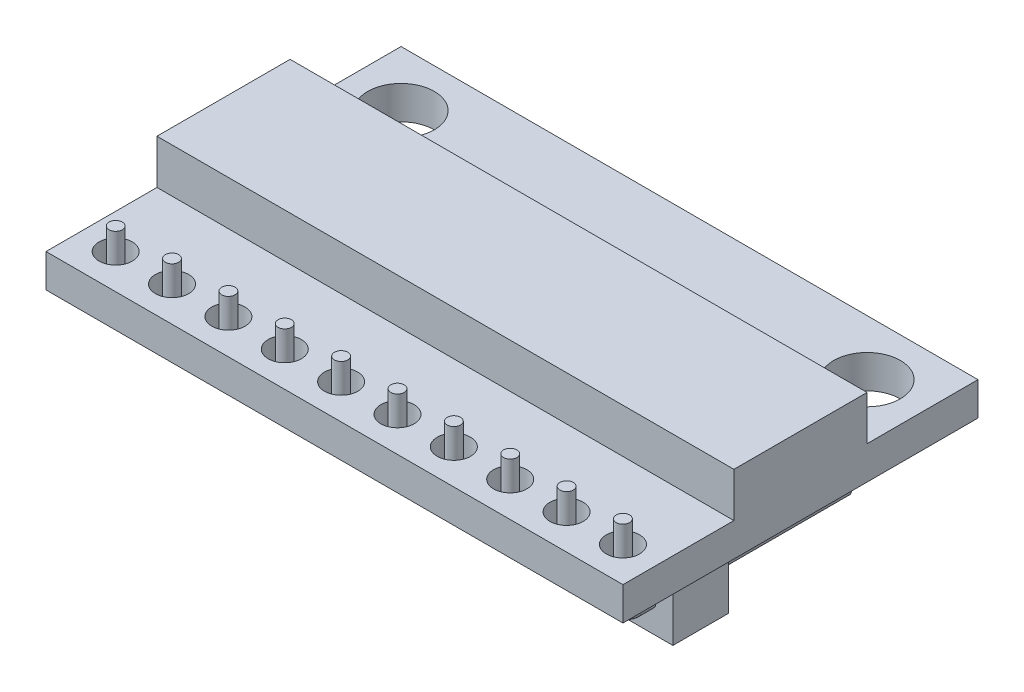
from build123d import *

# Parameters (mm, degrees)
SKETCH_1_W                    = 26
SKETCH_1_H                    = 16
EXTRUDE_1_DEPTH               = 1.5
SKETCH_2_R                    = 1.5
CUT_EXTRUDE_1_DEPTH           = 16.33786165
SKETCH_3_R                    = 0.75
CUT_EXTRUDE_2_DEPTH           = 3.5
SKETCH_4_W                    = 26
SKETCH_4_H                    = 6
EXTRUDE_2_DEPTH               = 2
SKETCH_7_W                    = 25
SKETCH_7_H                    = 2.5
EXTRUDE_4_DEPTH               = 2.5
SWEEP_1_OUTLINE_R             = 0.3
SWEEP_1_ANGLE                 = 90
SWEEP_START                   = -0.7500001
SWEEP_1_2_OUTLINE_R           = 0.3
SWEEP_1_2_DEPTH               = 3.2500001
SWEEP_START_2                 = 4
SWEEP_1_3_OUTLINE_R           = 0.3
SWEEP_1_3_DEPTH               = 1.9300001
SWEEP_START_3                 = -3.57
SWEEP_1_4_OUTLINE_R           = 0.3
SWEEP_1_4_DEPTH               = 7.57
PATTERN_LINEAR_1_OUTLINE_R    = 0.3
PATTERN_LINEAR_1_ANGLE        = 90
PATTERN_START                 = -0.7500001
PATTERN_LINEAR_1_2_OUTLINE_R  = 0.3
PATTERN_LINEAR_1_2_DEPTH      = 3.2500001
PATTERN_START_2               = 4
PATTERN_LINEAR_1_3_OUTLINE_R  = 0.3
PATTERN_LINEAR_1_3_DEPTH      = 1.9300001
PATTERN_START_3               = -3.57
PATTERN_LINEAR_1_4_OUTLINE_R  = 0.3
PATTERN_LINEAR_1_4_DEPTH      = 7.57
PATTERN_LINEAR_1_5_OUTLINE_R  = 0.3
PATTERN_LINEAR_1_5_DEPTH      = 3.2500001
PATTERN_LINEAR_1_6_OUTLINE_R  = 0.3
PATTERN_LINEAR_1_6_DEPTH      = 1.9300001
PATTERN_LINEAR_1_7_OUTLINE_R  = 0.3
PATTERN_LINEAR_1_7_DEPTH      = 7.57
PATTERN_LINEAR_1_8_OUTLINE_R  = 0.3
PATTERN_LINEAR_1_8_DEPTH      = 3.2500001
PATTERN_LINEAR_1_9_OUTLINE_R  = 0.3
PATTERN_LINEAR_1_9_DEPTH      = 1.9300001
PATTERN_LINEAR_1_10_OUTLINE_R = 0.3
PATTERN_LINEAR_1_10_DEPTH     = 7.57
PATTERN_LINEAR_1_11_OUTLINE_R = 0.3
PATTERN_LINEAR_1_11_DEPTH     = 3.2500001
PATTERN_LINEAR_1_12_OUTLINE_R = 0.3
PATTERN_LINEAR_1_12_DEPTH     = 1.9300001
PATTERN_LINEAR_1_13_OUTLINE_R = 0.3
PATTERN_LINEAR_1_13_DEPTH     = 7.57
PATTERN_LINEAR_1_14_OUTLINE_R = 0.3
PATTERN_LINEAR_1_14_DEPTH     = 3.2500001
PATTERN_LINEAR_1_15_OUTLINE_R = 0.3
PATTERN_LINEAR_1_15_DEPTH     = 1.9300001
PATTERN_LINEAR_1_16_OUTLINE_R = 0.3
PATTERN_LINEAR_1_16_DEPTH     = 7.57
PATTERN_LINEAR_1_17_OUTLINE_R = 0.3
PATTERN_LINEAR_1_17_DEPTH     = 3.2500001
PATTERN_LINEAR_1_18_OUTLINE_R = 0.3
PATTERN_LINEAR_1_18_DEPTH     = 1.9300001
PATTERN_LINEAR_1_19_OUTLINE_R = 0.3
PATTERN_LINEAR_1_19_DEPTH     = 7.57
PATTERN_LINEAR_1_20_OUTLINE_R = 0.3
PATTERN_LINEAR_1_20_DEPTH     = 3.2500001
PATTERN_LINEAR_1_21_OUTLINE_R = 0.3
PATTERN_LINEAR_1_21_DEPTH     = 1.9300001
PATTERN_LINEAR_1_22_OUTLINE_R = 0.3
PATTERN_LINEAR_1_22_DEPTH     = 7.57
PATTERN_LINEAR_1_23_OUTLINE_R = 0.3
PATTERN_LINEAR_1_23_DEPTH     = 3.2500001
PATTERN_LINEAR_1_24_OUTLINE_R = 0.3
PATTERN_LINEAR_1_24_DEPTH     = 1.9300001
PATTERN_LINEAR_1_25_OUTLINE_R = 0.3
PATTERN_LINEAR_1_25_DEPTH     = 7.57
PATTERN_LINEAR_1_26_OUTLINE_R = 0.3
PATTERN_LINEAR_1_26_DEPTH     = 3.2500001
PATTERN_LINEAR_1_27_OUTLINE_R = 0.3
PATTERN_LINEAR_1_27_DEPTH     = 1.9300001
PATTERN_LINEAR_1_28_OUTLINE_R = 0.3
PATTERN_LINEAR_1_28_DEPTH     = 7.57


with BuildPart() as part:
    # 스케치1 → 보스-돌출1 (new body)
    with BuildSketch(Plane(origin=(0, 0, 0), x_dir=(1, 0, 0), z_dir=(0, 1, 0))):
        Rectangle(SKETCH_1_W, SKETCH_1_H)
    extrude(amount=EXTRUDE_1_DEPTH)

    # 스케치2 → 컷-돌출1 (cut, through all)
    with BuildSketch(Plane(origin=(0, 1.5, 0), x_dir=(1, 0, 0), z_dir=(0, 1, 0))):
        with Locations(Location((-10.5, 5.5, 0), (0, 0, 270))):
            Circle(SKETCH_2_R)
        with Locations(Location((10.5, 5.5, 0), (0, 0, 90))):
            Circle(SKETCH_2_R)
    extrude(amount=-CUT_EXTRUDE_1_DEPTH, mode=Mode.SUBTRACT)

    # 스케치3 → 컷-돌출2 (cut)
    with BuildSketch(Plane(origin=(0, 1.5, 0), x_dir=(1, 0, 0), z_dir=(0, 1, 0))):
        with Locations(Location((-11.43, -6.43, 0), (0, 0, 270))):
            Circle(SKETCH_3_R)
        with Locations(Location((-8.89, -6.43, 0), (0, 0, 270))):
            Circle(SKETCH_3_R)
        with Locations(Location((-6.35, -6.43, 0), (0, 0, 270))):
            Circle(SKETCH_3_R)
        with Locations(Location((-3.81, -6.43, 0), (0, 0, 270))):
            Circle(SKETCH_3_R)
        with Locations(Location((-1.27, -6.43, 0), (0, 0, 270))):
            Circle(SKETCH_3_R)
        with Locations(Location((1.27, -6.43, 0), (0, 0, 270))):
            Circle(SKETCH_3_R)
        with Locations(Location((3.81, -6.43, 0), (0, 0, 270))):
            Circle(SKETCH_3_R)
        with Locations(Location((6.35, -6.43, 0), (0, 0, 270))):
            Circle(SKETCH_3_R)
        with Locations(Location((8.89, -6.43, 0), (0, 0, 270))):
            Circle(SKETCH_3_R)
        with Locations(Location((11.43, -6.43, 0), (0, 0, 270))):
            Circle(SKETCH_3_R)
    extrude(amount=-CUT_EXTRUDE_2_DEPTH, mode=Mode.SUBTRACT)

    # 스케치4 → 보스-돌출2 (add)
    with BuildSketch(Plane(origin=(0, 1.5, 0), x_dir=(1, 0, 0), z_dir=(0, 1, 0))):
        Rectangle(SKETCH_4_W, SKETCH_4_H)
    extrude(amount=EXTRUDE_2_DEPTH)

    # 스케치7 → 보스-돌출4 (add)
    with BuildSketch(Plane.XZ):
        with Locations((0, 4)):
            Rectangle(SKETCH_7_W, SKETCH_7_H)
    extrude(amount=EXTRUDE_4_DEPTH)



with BuildPart() as body_2:
    # 스윕1: read off the stored shape, not the designer's step
    # 스윕1 outline → 스윕1 (revolve)
    with BuildSketch(Plane(origin=(0, -0.75, 5.93), x_dir=(0, 0, 1), z_dir=(0, 1, 0))):
        with Locations((0.5, -11.43)):
            Circle(SWEEP_1_OUTLINE_R)
    revolve(axis=Axis((0, -0.75, 5.93), (1, 0, 0)), revolution_arc=SWEEP_1_ANGLE)

    # Sweep 1 2 outline → Sweep 1 2 (add)
    with BuildSketch(Plane(origin=(0, 0, 0), x_dir=(1, 0, 0), z_dir=(0, 1, 0)).offset(SWEEP_START)):
        with Locations((-11.43, -6.43)):
            Circle(SWEEP_1_2_OUTLINE_R)
    extrude(amount=SWEEP_1_2_DEPTH)


with BuildPart() as part_1:
    add(part.part)

    add(body_2.part)  # Sweep 1 3 merges body 2
    # Sweep 1 3 outline → Sweep 1 3 (add)
    with BuildSketch(Plane.XY.offset(SWEEP_START_2)):
        with Locations((-11.43, -1.25)):
            Circle(SWEEP_1_3_OUTLINE_R)
    extrude(amount=SWEEP_1_3_DEPTH)

    # Sweep 1 4 outline → Sweep 1 4 (add)
    with BuildSketch(Plane.XY.offset(SWEEP_START_3)):
        with Locations((-11.43, -1.25)):
            Circle(SWEEP_1_4_OUTLINE_R)
    extrude(amount=SWEEP_1_4_DEPTH)



with BuildPart() as body_2_2:
    # 선형 패턴1: read off the stored shape, not the designer's step
    # 선형 패턴1 outline → 선형 패턴1 (revolve)
    with BuildSketch(Plane(origin=(0, -0.75, 5.93), x_dir=(0, 0, 1), z_dir=(0, 1, 0))):
        with Locations((0.5, -8.89)):
            Circle(PATTERN_LINEAR_1_OUTLINE_R)
        with Locations((0.5, -6.35)):
            Circle(PATTERN_LINEAR_1_OUTLINE_R)
        with Locations((0.5, -3.81)):
            Circle(PATTERN_LINEAR_1_OUTLINE_R)
        with Locations((0.5, -1.27)):
            Circle(PATTERN_LINEAR_1_OUTLINE_R)
        with Locations((0.5, 1.27)):
            Circle(PATTERN_LINEAR_1_OUTLINE_R)
        with Locations((0.5, 3.81)):
            Circle(PATTERN_LINEAR_1_OUTLINE_R)
        with Locations((0.5, 6.35)):
            Circle(PATTERN_LINEAR_1_OUTLINE_R)
        with Locations((0.5, 8.89)):
            Circle(PATTERN_LINEAR_1_OUTLINE_R)
        with Locations((0.5, 11.43)):
            Circle(PATTERN_LINEAR_1_OUTLINE_R)
    revolve(axis=Axis((0, -0.75, 5.93), (1, 0, 0)), revolution_arc=PATTERN_LINEAR_1_ANGLE)

    # Pattern Linear 1 2 outline → Pattern Linear 1 2 (add)
    with BuildSketch(Plane(origin=(0, 0, 0), x_dir=(1, 0, 0), z_dir=(0, 1, 0)).offset(PATTERN_START)):
        with Locations((-8.89, -6.43)):
            Circle(PATTERN_LINEAR_1_2_OUTLINE_R)
    extrude(amount=PATTERN_LINEAR_1_2_DEPTH)


with BuildPart() as part_2:
    add(part_1.part)

    add(body_2_2.part)  # Pattern Linear 1 3 merges body 2 2
    # Pattern Linear 1 3 outline → Pattern Linear 1 3 (add)
    with BuildSketch(Plane.XY.offset(PATTERN_START_2)):
        with Locations((-8.89, -1.25)):
            Circle(PATTERN_LINEAR_1_3_OUTLINE_R)
    extrude(amount=PATTERN_LINEAR_1_3_DEPTH)

    # Pattern Linear 1 4 outline → Pattern Linear 1 4 (add)
    with BuildSketch(Plane.XY.offset(PATTERN_START_3)):
        with Locations((-8.89, -1.25)):
            Circle(PATTERN_LINEAR_1_4_OUTLINE_R)
    extrude(amount=PATTERN_LINEAR_1_4_DEPTH)

    # Pattern Linear 1 5 outline → Pattern Linear 1 5 (add)
    with BuildSketch(Plane(origin=(0, 0, 0), x_dir=(1, 0, 0), z_dir=(0, 1, 0)).offset(PATTERN_START)):
        with Locations((-6.35, -6.43)):
            Circle(PATTERN_LINEAR_1_5_OUTLINE_R)
    extrude(amount=PATTERN_LINEAR_1_5_DEPTH)

    # Pattern Linear 1 6 outline → Pattern Linear 1 6 (add)
    with BuildSketch(Plane.XY.offset(PATTERN_START_2)):
        with Locations((-6.35, -1.25)):
            Circle(PATTERN_LINEAR_1_6_OUTLINE_R)
    extrude(amount=PATTERN_LINEAR_1_6_DEPTH)

    # Pattern Linear 1 7 outline → Pattern Linear 1 7 (add)
    with BuildSketch(Plane.XY.offset(PATTERN_START_3)):
        with Locations((-6.35, -1.25)):
            Circle(PATTERN_LINEAR_1_7_OUTLINE_R)
    extrude(amount=PATTERN_LINEAR_1_7_DEPTH)

    # Pattern Linear 1 8 outline → Pattern Linear 1 8 (add)
    with BuildSketch(Plane(origin=(0, 0, 0), x_dir=(1, 0, 0), z_dir=(0, 1, 0)).offset(PATTERN_START)):
        with Locations((-3.81, -6.43)):
            Circle(PATTERN_LINEAR_1_8_OUTLINE_R)
    extrude(amount=PATTERN_LINEAR_1_8_DEPTH)

    # Pattern Linear 1 9 outline → Pattern Linear 1 9 (add)
    with BuildSketch(Plane.XY.offset(PATTERN_START_2)):
        with Locations((-3.81, -1.25)):
            Circle(PATTERN_LINEAR_1_9_OUTLINE_R)
    extrude(amount=PATTERN_LINEAR_1_9_DEPTH)

    # Pattern Linear 1 10 outline → Pattern Linear 1 10 (add)
    with BuildSketch(Plane.XY.offset(PATTERN_START_3)):
        with Locations((-3.81, -1.25)):
            Circle(PATTERN_LINEAR_1_10_OUTLINE_R)
    extrude(amount=PATTERN_LINEAR_1_10_DEPTH)

    # Pattern Linear 1 11 outline → Pattern Linear 1 11 (add)
    with BuildSketch(Plane(origin=(0, 0, 0), x_dir=(1, 0, 0), z_dir=(0, 1, 0)).offset(PATTERN_START)):
        with Locations((-1.27, -6.43)):
            Circle(PATTERN_LINEAR_1_11_OUTLINE_R)
    extrude(amount=PATTERN_LINEAR_1_11_DEPTH)

    # Pattern Linear 1 12 outline → Pattern Linear 1 12 (add)
    with BuildSketch(Plane.XY.offset(PATTERN_START_2)):
        with Locations((-1.27, -1.25)):
            Circle(PATTERN_LINEAR_1_12_OUTLINE_R)
    extrude(amount=PATTERN_LINEAR_1_12_DEPTH)

    # Pattern Linear 1 13 outline → Pattern Linear 1 13 (add)
    with BuildSketch(Plane.XY.offset(PATTERN_START_3)):
        with Locations((-1.27, -1.25)):
            Circle(PATTERN_LINEAR_1_13_OUTLINE_R)
    extrude(amount=PATTERN_LINEAR_1_13_DEPTH)

    # Pattern Linear 1 14 outline → Pattern Linear 1 14 (add)
    with BuildSketch(Plane(origin=(0, 0, 0), x_dir=(1, 0, 0), z_dir=(0, 1, 0)).offset(PATTERN_START)):
        with Locations((1.27, -6.43)):
            Circle(PATTERN_LINEAR_1_14_OUTLINE_R)
    extrude(amount=PATTERN_LINEAR_1_14_DEPTH)

    # Pattern Linear 1 15 outline → Pattern Linear 1 15 (add)
    with BuildSketch(Plane.XY.offset(PATTERN_START_2)):
        with Locations((1.27, -1.25)):
            Circle(PATTERN_LINEAR_1_15_OUTLINE_R)
    extrude(amount=PATTERN_LINEAR_1_15_DEPTH)

    # Pattern Linear 1 16 outline → Pattern Linear 1 16 (add)
    with BuildSketch(Plane.XY.offset(PATTERN_START_3)):
        with Locations((1.27, -1.25)):
            Circle(PATTERN_LINEAR_1_16_OUTLINE_R)
    extrude(amount=PATTERN_LINEAR_1_16_DEPTH)

    # Pattern Linear 1 17 outline → Pattern Linear 1 17 (add)
    with BuildSketch(Plane(origin=(0, 0, 0), x_dir=(1, 0, 0), z_dir=(0, 1, 0)).offset(PATTERN_START)):
        with Locations((3.81, -6.43)):
            Circle(PATTERN_LINEAR_1_17_OUTLINE_R)
    extrude(amount=PATTERN_LINEAR_1_17_DEPTH)

    # Pattern Linear 1 18 outline → Pattern Linear 1 18 (add)
    with BuildSketch(Plane.XY.offset(PATTERN_START_2)):
        with Locations((3.81, -1.25)):
            Circle(PATTERN_LINEAR_1_18_OUTLINE_R)
    extrude(amount=PATTERN_LINEAR_1_18_DEPTH)

    # Pattern Linear 1 19 outline → Pattern Linear 1 19 (add)
    with BuildSketch(Plane.XY.offset(PATTERN_START_3)):
        with Locations((3.81, -1.25)):
            Circle(PATTERN_LINEAR_1_19_OUTLINE_R)
    extrude(amount=PATTERN_LINEAR_1_19_DEPTH)

    # Pattern Linear 1 20 outline → Pattern Linear 1 20 (add)
    with BuildSketch(Plane(origin=(0, 0, 0), x_dir=(1, 0, 0), z_dir=(0, 1, 0)).offset(PATTERN_START)):
        with Locations((6.35, -6.43)):
            Circle(PATTERN_LINEAR_1_20_OUTLINE_R)
    extrude(amount=PATTERN_LINEAR_1_20_DEPTH)

    # Pattern Linear 1 21 outline → Pattern Linear 1 21 (add)
    with BuildSketch(Plane.XY.offset(PATTERN_START_2)):
        with Locations((6.35, -1.25)):
            Circle(PATTERN_LINEAR_1_21_OUTLINE_R)
    extrude(amount=PATTERN_LINEAR_1_21_DEPTH)

    # Pattern Linear 1 22 outline → Pattern Linear 1 22 (add)
    with BuildSketch(Plane.XY.offset(PATTERN_START_3)):
        with Locations((6.35, -1.25)):
            Circle(PATTERN_LINEAR_1_22_OUTLINE_R)
    extrude(amount=PATTERN_LINEAR_1_22_DEPTH)

    # Pattern Linear 1 23 outline → Pattern Linear 1 23 (add)
    with BuildSketch(Plane(origin=(0, 0, 0), x_dir=(1, 0, 0), z_dir=(0, 1, 0)).offset(PATTERN_START)):
        with Locations((8.89, -6.43)):
            Circle(PATTERN_LINEAR_1_23_OUTLINE_R)
    extrude(amount=PATTERN_LINEAR_1_23_DEPTH)

    # Pattern Linear 1 24 outline → Pattern Linear 1 24 (add)
    with BuildSketch(Plane.XY.offset(PATTERN_START_2)):
        with Locations((8.89, -1.25)):
            Circle(PATTERN_LINEAR_1_24_OUTLINE_R)
    extrude(amount=PATTERN_LINEAR_1_24_DEPTH)

    # Pattern Linear 1 25 outline → Pattern Linear 1 25 (add)
    with BuildSketch(Plane.XY.offset(PATTERN_START_3)):
        with Locations((8.89, -1.25)):
            Circle(PATTERN_LINEAR_1_25_OUTLINE_R)
    extrude(amount=PATTERN_LINEAR_1_25_DEPTH)

    # Pattern Linear 1 26 outline → Pattern Linear 1 26 (add)
    with BuildSketch(Plane(origin=(0, 0, 0), x_dir=(1, 0, 0), z_dir=(0, 1, 0)).offset(PATTERN_START)):
        with Locations((11.43, -6.43)):
            Circle(PATTERN_LINEAR_1_26_OUTLINE_R)
    extrude(amount=PATTERN_LINEAR_1_26_DEPTH)

    # Pattern Linear 1 27 outline → Pattern Linear 1 27 (add)
    with BuildSketch(Plane.XY.offset(PATTERN_START_2)):
        with Locations((11.43, -1.25)):
            Circle(PATTERN_LINEAR_1_27_OUTLINE_R)
    extrude(amount=PATTERN_LINEAR_1_27_DEPTH)

    # Pattern Linear 1 28 outline → Pattern Linear 1 28 (add)
    with BuildSketch(Plane.XY.offset(PATTERN_START_3)):
        with Locations((11.43, -1.25)):
            Circle(PATTERN_LINEAR_1_28_OUTLINE_R)
    extrude(amount=PATTERN_LINEAR_1_28_DEPTH)


solid = part_2.part
